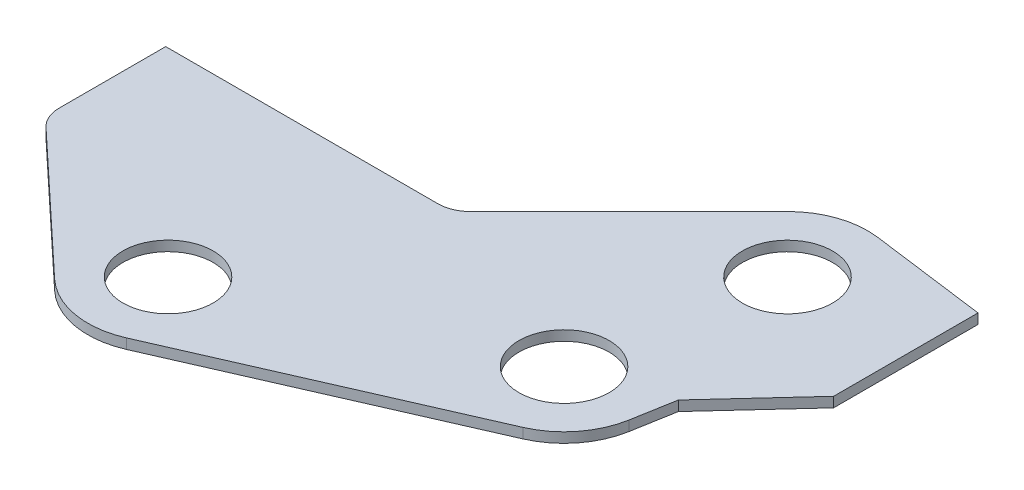
from build123d import *

# Parameters (mm, degrees)
SKETCH1_R           = 14.29004
BOSS_EXTRUDE1_DEPTH = 3.175
FILLET1_R           = 10
FILLET2_R           = 10


with BuildPart() as part:
    # Sketch1 → Boss-Extrude1 (new body)
    with BuildSketch(Plane(origin=(0, 0, 0), x_dir=(1, 0, 0), z_dir=(0, 1, 0))):
        with BuildLine():
            Line((-62.06952, -79.895280222), (25.163028109, -41.695780276))
            ThreePointArc((25.163028109, -41.695780276), (34.911191298, -34.148496119), (39.936134607, -22.890693115))
            Line((39.936134607, -22.890693115), (42.271095404, -9.586739751))
            Line((42.271095404, -9.586739751), (65.82695514, 16.012754812))
            Line((65.82695514, 16.012754812), (65.826833771, 61.726825209))
            Line((65.826833771, 61.726825209), (29.162987319, 66.591916163))
            ThreePointArc((29.162987319, 66.591916163), (17.671984848, 65.469640039), (7.864900148, 59.376715357))
            Line((7.864900148, 59.376715357), (-32.663625178, 18.864335762))
            Line((-32.663625178, 18.864335762), (-45.368686614, 6.164335762))
            Line((-45.368686614, 6.164335762), (-135.78566057, 6.164335762))
            Line((-135.78566057, 6.164335762), (-135.78566057, -31.935664238))
            Line((-135.78566057, -31.935664238), (-89.620113812, -75.16814328))
            ThreePointArc((-89.620113812, -75.16814328), (-76.553580444, -81.662511553), (-62.06952, -79.895280222))
        make_face()
        with Locations((25.821833771, 41.412625209)):
            Circle(SKETCH1_R, mode=Mode.SUBTRACT)
        with Locations((15.012562201, -18.516537909)):
            Circle(SKETCH1_R, mode=Mode.SUBTRACT)
        with Locations((-72.258332946, -56.628468385)):
            Circle(SKETCH1_R, mode=Mode.SUBTRACT)
    extrude(amount=BOSS_EXTRUDE1_DEPTH)

    # Fillet1
    fillet1_edges = [part.edges().sort_by_distance(p)[0] for p in [
        (-135.78566057, 1.5875, 31.935664238),
    ]]
    fillet(fillet1_edges, radius=FILLET1_R)

    # Fillet2
    fillet2_edges = [part.edges().sort_by_distance(p)[0] for p in [
        (-45.368686614, 1.5875, -6.164335762),
    ]]
    fillet(fillet2_edges, radius=FILLET2_R)


solid = part.part
